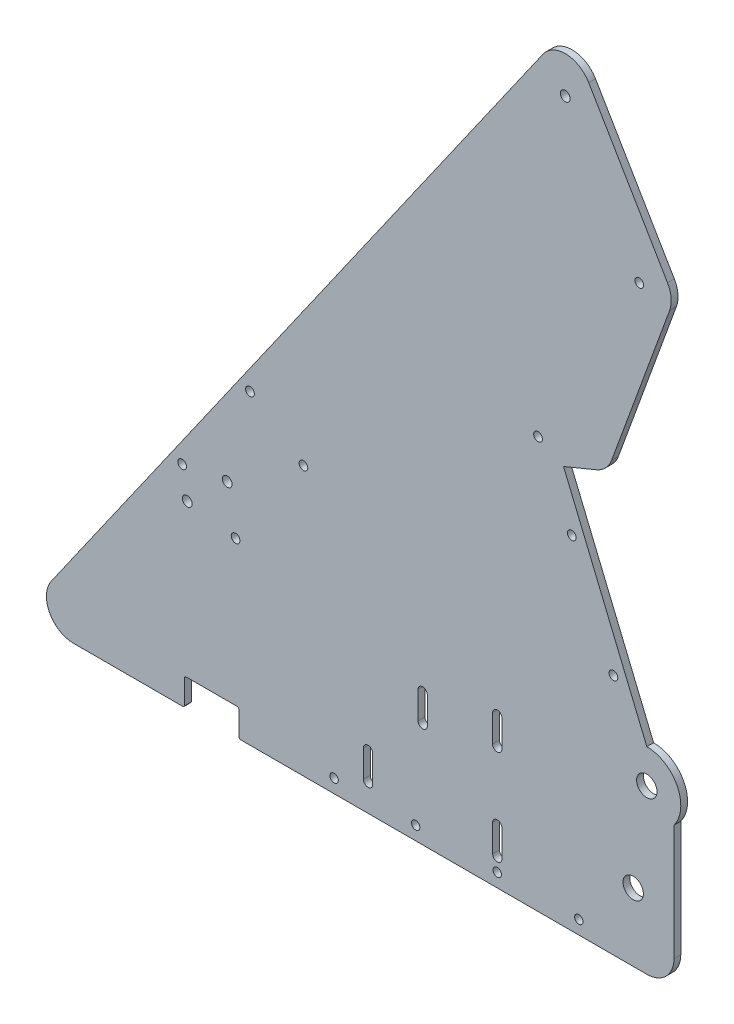
from build123d import *

# Parameters (mm, degrees)
BOSS_EXTRUDE1_DEPTH = 3.175
SKETCH2_R           = 2.286
SKETCH2_R_2         = 2.032
SKETCH2_R_3         = 4.7625
SKETCH2_R_4         = 1.96820932
CUT_EXTRUDE1_DEPTH  = 477.903574071
FILLET1_R           = 12.7
FILLET2_R           = 0.79375
CUT_EXTRUDE2_DEPTH  = 469.734945764


with BuildPart() as part:
    # Sketch1 → Boss-Extrude1 (new body)
    with BuildSketch(Plane.XY):
        with BuildLine():
            Line((0, 0), (76.2, 0))
            Line((76.2, 0), (76.2, 12.7))
            Line((76.2, 12.7), (101.6, 12.7))
            Line((101.6, 12.7), (101.6, 0))
            Line((101.6, 0), (304.8, 0))
            Line((304.8, 0), (304.8, 66.675))
            ThreePointArc((304.8, 66.675), (306.299031657, 83.299515829), (292.1, 92.075))
            Line((292.1, 92.075), (253.219363272, 185.941160503))
            Line((253.219363272, 185.941160503), (273.752585882, 194.446299787))
            Line((273.752585882, 194.446299787), (304.8, 279.4))
            Line((304.8, 279.4), (254.954725958, 364.113083686))
            Line((254.954725958, 364.113083686), (0, 0))
        make_face()
    extrude(amount=BOSS_EXTRUDE1_DEPTH)

    # Sketch2 → Cut-Extrude1 (cut, through all)
    with BuildSketch(Plane.XY.offset(3.175)):
        with Locations((77.458296873, 84.051783119)):
            Circle(SKETCH2_R)
        with Locations((254, 336.179464547)):
            Circle(SKETCH2_R)
        with Locations((96.115774714, 101.28716883)):
            Circle(SKETCH2_R)
        with Locations((257.072887422, 160.044580582)):
            Circle(SKETCH2_R_2)
        with Locations((292.1, 76.2)):
            Circle(SKETCH2_R_3)
        with Locations((184.15, 6.35)):
            Circle(SKETCH2_R_4)
        with Locations((222.25, 6.35)):
            Circle(SKETCH2_R_4)
        with Locations((260.35, 6.35)):
            Circle(SKETCH2_R_4)
        with Locations((276.513205786, 113.11150033)):
            Circle(SKETCH2_R_2)
        with Locations((288.600184498, 277.926110751)):
            Circle(SKETCH2_R_2)
        with Locations((285.75, 31.75)):
            Circle(SKETCH2_R_3)
        with Locations((106.759933414, 143.058732026)):
            Circle(SKETCH2_R_2)
        with Locations((241.3, 192.0875)):
            Circle(SKETCH2_R_2)
        with Locations((75.072703188, 97.804677339)):
            Circle(SKETCH2_R_2)
        with Locations((100.040457498, 80.322067559)):
            Circle(SKETCH2_R_2)
        with Locations((131.727687724, 125.576122246)):
            Circle(SKETCH2_R_2)
        with Locations((146.05, 6.35)):
            Circle(SKETCH2_R_4)
    extrude(amount=-CUT_EXTRUDE1_DEPTH, mode=Mode.SUBTRACT)

    # Fillet1
    fillet1_edges = [part.edges().sort_by_distance(p)[0] for p in [
        (0, 0, 1.5875),
        (304.8, 0, 1.5875),
        (254.954725958, 364.113083686, 1.5875),
        (273.752585882, 194.446299787, 1.5875),
        (304.8, 279.4, 1.5875),
    ]]
    fillet(fillet1_edges, radius=FILLET1_R)

    # Fillet2
    fillet2_edges = [part.edges().sort_by_distance(p)[0] for p in [
        (101.6, 0, 1.5875),
        (101.6, 12.7, 1.5875),
        (76.2, 0, 1.5875),
        (76.2, 12.7, 1.5875),
    ]]
    fillet(fillet2_edges, radius=FILLET2_R)

    # Sketch7 → Cut-Extrude2 (cut, through all)
    with BuildSketch(Plane.XY.offset(3.175)):
        with BuildLine():
            Line((220.091, 12.7), (220.091, 25.4))
            ThreePointArc((220.091, 25.4), (222.25, 27.559), (224.409, 25.4))
            Line((224.409, 25.4), (224.409, 12.7))
            ThreePointArc((224.409, 12.7), (222.25, 10.541), (220.091, 12.7))
        make_face()
        with BuildLine():
            Line((220.091, 57.15), (220.091, 69.85))
            ThreePointArc((220.091, 69.85), (222.25, 72.009), (224.409, 69.85))
            Line((224.409, 69.85), (224.409, 57.15))
            ThreePointArc((224.409, 57.15), (222.25, 54.991), (220.091, 57.15))
        make_face()
        with BuildLine():
            Line((185.261472596, 49.111308369), (185.261472596, 61.811308369))
            ThreePointArc((185.261472596, 61.811308369), (187.420472596, 63.970308369), (189.579472596, 61.811308369))
            Line((189.579472596, 61.811308369), (189.579472596, 49.111308369))
            ThreePointArc((189.579472596, 49.111308369), (187.420472596, 46.952308369), (185.261472596, 49.111308369))
        make_face()
        with BuildLine():
            Line((159.766, 12.7), (159.766, 25.4))
            ThreePointArc((159.766, 25.4), (161.925, 27.559), (164.084, 25.4))
            Line((164.084, 25.4), (164.084, 12.7))
            ThreePointArc((164.084, 12.7), (161.925, 10.541), (159.766, 12.7))
        make_face()
    extrude(amount=-CUT_EXTRUDE2_DEPTH, mode=Mode.SUBTRACT)


solid = part.part
